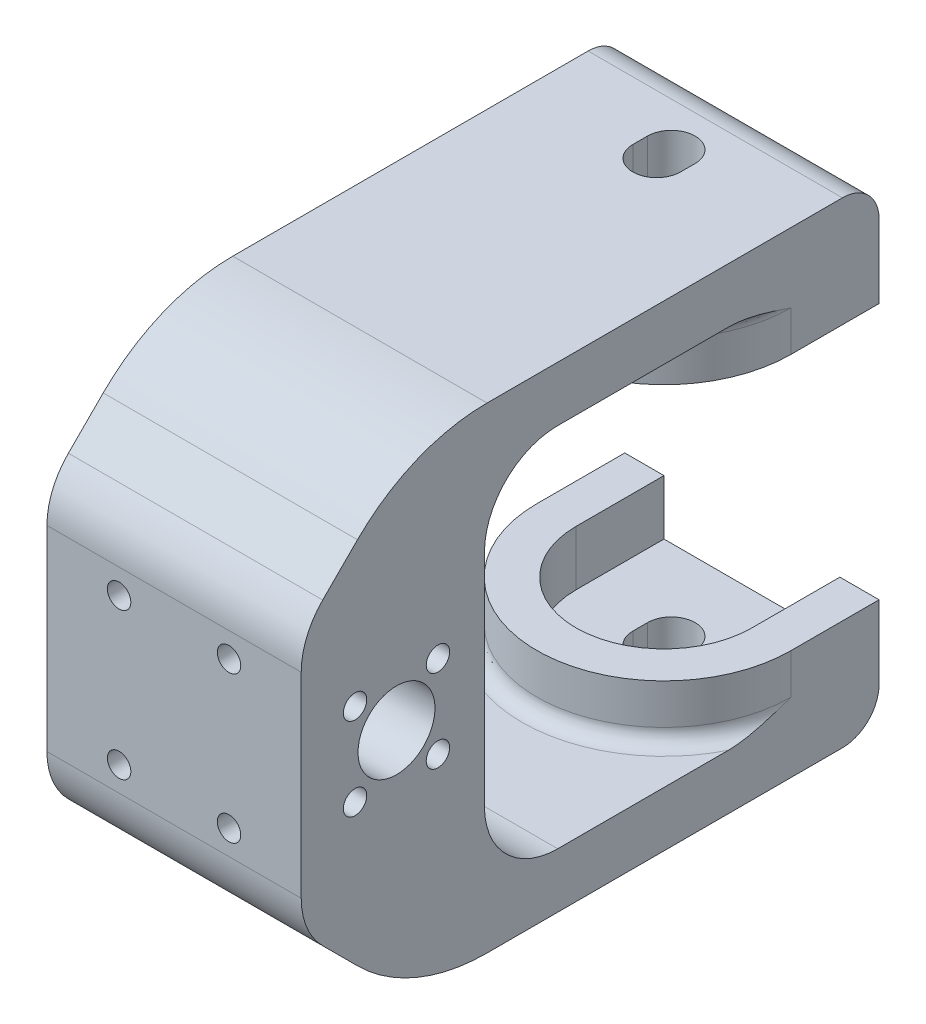
from build123d import *

# Parameters (mm, degrees)
SKETCH1_W               = 34.7
SKETCH1_H               = 27
SKETCH1_R               = 1.6
BOSS_EXTRUDE1_DEPTH     = 25
SKETCH4_R               = 1.6
SKETCH4_R_2             = 5.25
BASE_EXTRUDE_DEPTH      = 45.847965394
SKETCH4_3_R             = 11.25
SKETCH4_3_R_2           = 5.25
SKETCH4_3_R_3           = 1.6
CUT_EXTRUDE3_DEPTH      = 5
BOSS_EXTRUDE5_DEPTH     = 34.7
CHAMFER3_SIZE           = 12.5
CHAMFER3_SIZE2          = 15
FILLET1_R               = 10
FILLET3_R               = 20
FILLET4_R               = 7.5
BOSS_EXTRUDE6_DEPTH     = 7.5
FILLET5_R               = 2
SKETCH13_R              = 3.25
CUT_EXTRUDE5_DEPTH      = 18.5
CHAMFER4_SIZE           = 15
FILLET11_R              = 10
FILLET12_R              = 25
FILLET13_R              = 5
CUT_EXTRUDE6_DEPTH      = 66.246417783
CUT_EXTRUDE6_DEPTH_BACK = 66.246417783


with BuildPart() as part:
    # Sketch1 → Boss-Extrude1 (new body)
    with BuildSketch(Plane.XY):
        Rectangle(SKETCH1_W, SKETCH1_H)
        with Locations((-7.5, -10)):
            Circle(SKETCH1_R, mode=Mode.SUBTRACT)
        with Locations(Location((7.5, -10, 0), (0, 0, 180))):
            Circle(SKETCH1_R, mode=Mode.SUBTRACT)
        with Locations((7.5, 10)):
            Circle(SKETCH1_R, mode=Mode.SUBTRACT)
        with Locations(Location((-7.5, 10, 0), (0, 0, 180))):
            Circle(SKETCH1_R, mode=Mode.SUBTRACT)
    extrude(amount=BOSS_EXTRUDE1_DEPTH)

    # Sketch4 → Base Extrude (cut, through all)
    with BuildSketch(Plane.ZY.offset(17.35)):
        with Locations((6.343145751, 5.656854249)):
            Circle(SKETCH4_R)
        with Locations((17.656854249, 5.656854249)):
            Circle(SKETCH4_R)
        with Locations((17.656854249, -5.656854249)):
            Circle(SKETCH4_R)
        with Locations((6.343145751, -5.656854249)):
            Circle(SKETCH4_R)
        with Locations((12, 0)):
            Circle(SKETCH4_R_2)
    extrude(amount=-BASE_EXTRUDE_DEPTH, mode=Mode.SUBTRACT)

    # Sketch4<3> → Cut-Extrude3 (cut)
    with BuildSketch(Plane.ZY.offset(17.35)):
        with Locations((12, 0)):
            Circle(SKETCH4_3_R)
        with Locations((12, 0)):
            Circle(SKETCH4_3_R_2, mode=Mode.SUBTRACT)
        with Locations((6.343145751, 5.656854249)):
            Circle(SKETCH4_3_R_3, mode=Mode.SUBTRACT)
        with Locations((17.656854249, 5.656854249)):
            Circle(SKETCH4_3_R_3, mode=Mode.SUBTRACT)
        with Locations((17.656854249, -5.656854249)):
            Circle(SKETCH4_3_R_3, mode=Mode.SUBTRACT)
        with Locations((6.343145751, -5.656854249)):
            Circle(SKETCH4_3_R_3, mode=Mode.SUBTRACT)
    extrude(amount=-CUT_EXTRUDE3_DEPTH, mode=Mode.SUBTRACT)

    # Sketch10 → Boss-Extrude5 (add)
    with BuildSketch(Plane(origin=(17.35, 0, 0), x_dir=(0, 0, -1), z_dir=(1, 0, 0))):
        Polygon((0, 13.5), (0, 25), (53.849999999, 25), (53.849999999, 32.5), (-25, 32.5), (-25, 13.5), align=None)
        Polygon((-25, -13.5), (-25, -32.5), (53.849999999, -32.5), (53.849999999, -25), (0, -25), (0, -13.5), align=None)
    extrude(amount=-BOSS_EXTRUDE5_DEPTH)

    # Chamfer3
    chamfer3_edges = [part.edges().sort_by_distance(p)[0] for p in [
        (0, 32.5, 25),
    ]]
    chamfer3_side = [part.faces().sort_by_distance(p)[0] for p in [
        (0, 0, 25),
    ]]
    chamfer(chamfer3_edges, length=CHAMFER3_SIZE, length2=CHAMFER3_SIZE2, reference=chamfer3_side[0])

    # Fillet1
    fillet1_edges = [part.edges().sort_by_distance(p)[0] for p in [
        (0, 25, 0),
    ]]
    fillet(fillet1_edges, radius=FILLET1_R)

    # Fillet3
    fillet3_edges = [part.edges().sort_by_distance(p)[0] for p in [
        (0, 32.5, 10),
    ]]
    fillet(fillet3_edges, radius=FILLET3_R)

    # Fillet4
    fillet4_edges = [part.edges().sort_by_distance(p)[0] for p in [
        (0, 20, 25),
    ]]
    fillet(fillet4_edges, radius=FILLET4_R)

    # Sketch11 → Boss-Extrude6 (add)
    with BuildSketch(Plane.XZ.offset(-25)):
        with BuildLine():
            Line((-12, -53.849999999), (-17.35, -53.849999999))
            Line((-17.35, -53.849999999), (-17.35, -41.849999999))
            ThreePointArc((-17.35, -41.849999999), (0, -24.499999999), (17.35, -41.849999999))
            Line((17.35, -41.849999999), (17.35, -53.849999999))
            Line((17.35, -53.849999999), (12, -53.849999999))
            Line((12, -53.849999999), (12, -41.849999999))
            ThreePointArc((12, -41.849999999), (0, -29.849999999), (-12, -41.849999999))
            Line((-12, -41.849999999), (-12, -53.849999999))
        make_face()
    extrude(amount=BOSS_EXTRUDE6_DEPTH)

    # Fillet5
    # the kernel refuses this fillet: 2 mm, written as the material it adds along each edge
    with BuildSketch(Plane(origin=(0, 25, -41.849999999), x_dir=(-0.9586337455117862, 0, -0.28464248095820854), z_dir=(0.28464248095820854, 0, -0.9586337455117862))) as fillet5_piece_1_section:
        with BuildLine():
            CenterArc((19.3499, -1.9999), FILLET5_R, 90, 90)
            Line((17.3499, -1.9999), (17.3099, -1.9999))
            ThreePointArc((17.3099, -1.9999), (17.31, -0.99995), (17.31, 0))
            Line((17.31, 0), (17.35, 0.04))
            ThreePointArc((17.35, 0.04), (18.34995, 0.04), (19.3499, 0.0401))
            Line((19.3499, 0.0401), (19.3499, 0.0001))
        make_face()
    fillet5_piece_1 = revolve(axis=Axis((0, 25, -41.849999999), (0, 1, 0)), revolution_arc=213.074958292, mode=Mode.PRIVATE)
    fillet5_piece_1 = split(fillet5_piece_1, bisect_by=Plane(origin=(17.35, 24.441377489, -23.941377488), z_dir=(-1, 0, 0)), keep=Keep.TOP, mode=Mode.PRIVATE)
    fillet5_piece_1 = split(fillet5_piece_1, bisect_by=Plane(origin=(-17.35, 24.441377489, -23.941377488), z_dir=(1, 0, 0)), keep=Keep.TOP, mode=Mode.PRIVATE)
    add(fillet5_piece_1)

    # Sketch13 → Cut-Extrude5 (cut)
    with BuildSketch(Plane.XZ.offset(-25)):
        with Locations(Location((0, -41.849999999, 0), (0, 0, 270))):
            Circle(SKETCH13_R)
    extrude(amount=-CUT_EXTRUDE5_DEPTH, mode=Mode.SUBTRACT)

    # Mirror12: part across plane


with BuildPart() as part_1:
    add(part.part)
    add(part.part.mirror(Plane.ZX))

    # Chamfer4
    chamfer4_edges = [part_1.edges().sort_by_distance(p)[0] for p in [
        (0, 32.5, 25),
        (0, -32.5, 25),
    ]]
    chamfer(chamfer4_edges, length=CHAMFER4_SIZE)

    # Fillet11
    fillet11_edges = [part_1.edges().sort_by_distance(p)[0] for p in [
        (0, 17.5, 25),
        (0, -17.5, 25),
    ]]
    fillet(fillet11_edges, radius=FILLET11_R)

    # Fillet12
    fillet12_edges = [part_1.edges().sort_by_distance(p)[0] for p in [
        (0, -32.5, 10),
        (0, 32.5, 10),
    ]]
    fillet(fillet12_edges, radius=FILLET12_R)

    # Fillet13
    fillet13_edges = [part_1.edges().sort_by_distance(p)[0] for p in [
        (0, 32.5, -53.849999999),
        (0, -32.5, -53.849999999),
    ]]
    fillet(fillet13_edges, radius=FILLET13_R)

    # Sketch14 → Cut-Extrude6 (cut, two sides: drawn at the far end of the back side and taken through both)
    with BuildSketch(Plane(origin=(0, 0, 0), x_dir=(1, 0, 0), z_dir=(0, 1, 0)).offset(-CUT_EXTRUDE6_DEPTH_BACK)):
        with BuildLine():
            Line((-3.25, 40.849999999), (-3.25, 42.849999999))
            ThreePointArc((-3.25, 42.849999999), (0, 46.099999999), (3.25, 42.849999999))
            Line((3.25, 42.849999999), (3.25, 40.849999999))
            ThreePointArc((3.25, 40.849999999), (0, 37.599999999), (-3.25, 40.849999999))
        make_face()
    extrude(amount=CUT_EXTRUDE6_DEPTH + CUT_EXTRUDE6_DEPTH_BACK, mode=Mode.SUBTRACT)


solid = part_1.part
